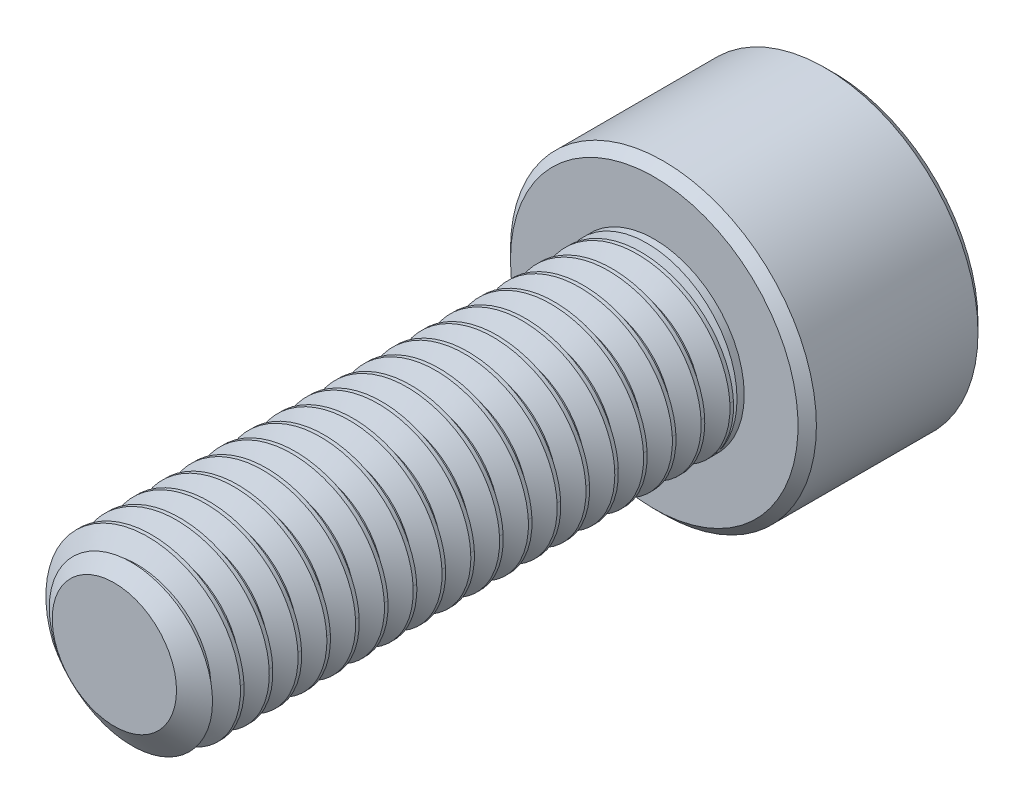
from build123d import *

# Parameters (mm, degrees)
SKETCH1_R          = 2.5
EXTRUDE1_DEPTH     = 15
CUT_SWEEP1_PITCH   = 0.8
SKETCH6_R          = 4.25
EXTRUDE2_DEPTH     = 5
CUT_EXTRUDE1_DEPTH = 3
CHAMFER1_SIZE      = 0.255


with BuildPart() as part:
    # Sketch1 → Extrude1 (new body)
    with BuildSketch(Plane.XY):
        Circle(SKETCH1_R)
    extrude(amount=-EXTRUDE1_DEPTH)

    # Cut-Sweep1: arcs per turn and ends read off the stored shape
    # Cut-Sweep1: the profile of Sketch3 profile screwed along a right-hand helix through 21 turns, 6 arcs to a turn; built about Z, then put on its axis
    cut_sweep1_z = Axis((0, 0, 0), (0, 0, 1))
    cut_sweep1_corners = [(2.5003, 0, -1.500173205), (1.980384758, 0, -1.2), (1.980384758, 0, -1.1), (2.5003, 0, -0.799826795)]
    with BuildLine(mode=Mode.PRIVATE) as cut_sweep1_profile:
        Line(cut_sweep1_corners[0], cut_sweep1_corners[1])
        Line(cut_sweep1_corners[1], cut_sweep1_corners[2])
        Line(cut_sweep1_corners[2], cut_sweep1_corners[3])
        Line(cut_sweep1_corners[3], cut_sweep1_corners[0])
    cut_sweep1_cap = Face(cut_sweep1_profile.wire())
    cut_sweep1_turn_angles = [0, 30, 60, 90, 120, 150, 180, 210, 240, 270, 300, 330, 360]
    cut_sweep1_turn_weights = [1, 0.8660254037844387, 1, 0.8660254037844387, 1, 0.8660254037844387, 1, 0.8660254037844387, 1, 0.8660254037844387, 1, 0.8660254037844387, 1]
    cut_sweep1_turn_rails = [Edge.make_bspline([Vector(p[0], p[1], 0).rotate(cut_sweep1_z, cut_sweep1_turn_angles[k]) / cut_sweep1_turn_weights[k] + Vector(0, 0, p[2] + CUT_SWEEP1_PITCH * cut_sweep1_turn_angles[k] / 360) for k in range(13)], [0, 0, 0, 1, 1, 2, 2, 3, 3, 4, 4, 5, 5, 6, 6, 6], 2, cut_sweep1_turn_weights) for p in cut_sweep1_corners]
    cut_sweep1_turn_sides = [Face.make_surface_from_curves(cut_sweep1_turn_rails[p[0]], cut_sweep1_turn_rails[p[1]]) for p in [(0, 1), (1, 2), (2, 3), (3, 0)]]
    cut_sweep1 = Plane(origin=(0, 0, 0), x_dir=(0, 1, 0), z_dir=(0, 0, -1)) * Solid(Shell([*[p.moved(Location((0, 0, CUT_SWEEP1_PITCH * i))) for i in range(21) for p in cut_sweep1_turn_sides], cut_sweep1_cap, cut_sweep1_cap.rotate(cut_sweep1_z, 7560).moved(Location((0, 0, CUT_SWEEP1_PITCH * 7560 / 360)))]))
    add(cut_sweep1, mode=Mode.SUBTRACT)

    # Sketch4 → Cut-Revolve1 (revolve, cut)
    with BuildSketch(Plane(origin=(0, 0, 0), x_dir=(0, 0, -1), z_dir=(1, 0, 0)), mode=Mode.PRIVATE) as cut_revolve1_sk:
        Polygon((0.541691224, 2.5), (0, 1.726384758), (0, 2.5), align=None)
    revolve(cut_revolve1_sk.sketch.rotate(Axis((0, 0, 0), (0, 0, -1)), 90), axis=Axis((0, 0, 0), (0, 0, -1)), mode=Mode.SUBTRACT)

    # Sketch6 → Extrude2 (add)
    with BuildSketch(Plane(origin=(0, 0, -15), x_dir=(-1, 0, 0), z_dir=(0, 0, -1))):
        with Locations(Location((0, 0, 0), (0, 0, 180))):
            Circle(SKETCH6_R)
    extrude(amount=EXTRUDE2_DEPTH)

    # Sketch7 → Cut-Extrude1 (cut)
    with BuildSketch(Plane(origin=(0, 0, -20), x_dir=(-1, 0, 0), z_dir=(0, 0, -1))):
        Polygon((0, 2.309401077), (-2, 1.154700538), (-2, -1.154700538), (0, -2.309401077), (2, -1.154700538), (2, 1.154700538), align=None)
    extrude(amount=-CUT_EXTRUDE1_DEPTH, mode=Mode.SUBTRACT)

    # Cut-Extrude2 cone 1 section (through the dimple's axis) → Cut-Extrude2 (revolve, cut)
    with BuildSketch(Plane(origin=(0, 0, -20), x_dir=(0, 1, 0), z_dir=(1, 0, 0))):
        Polygon((0, 0), (2.309401077, 0), (0, 2.309401077), align=None)
    revolve(axis=Axis((0, 0, -20), (0, 0, 1)), mode=Mode.SUBTRACT)

    # Chamfer1
    chamfer1_edges = [part.edges().sort_by_distance(p)[0] for p in [
        (-4.25, 0, -15),
        (-4.25, 0, -20),
    ]]
    chamfer(chamfer1_edges, length=CHAMFER1_SIZE)

    # Sketch10 → Revolve1 (revolve)
    with BuildSketch(Plane(origin=(0, 0, 0), x_dir=(0, 0, -1), z_dir=(1, 0, 0)), mode=Mode.PRIVATE) as revolve1_sk:
        Polygon((15, 2.5), (15, 0), (13.764466094, 0), (14.8, 2.5), align=None)
    revolve(revolve1_sk.sketch.rotate(Axis((0, 0, -15), (0, 0, 1)), 270), axis=Axis((0, 0, -15), (0, 0, 1)))


solid = part.part
